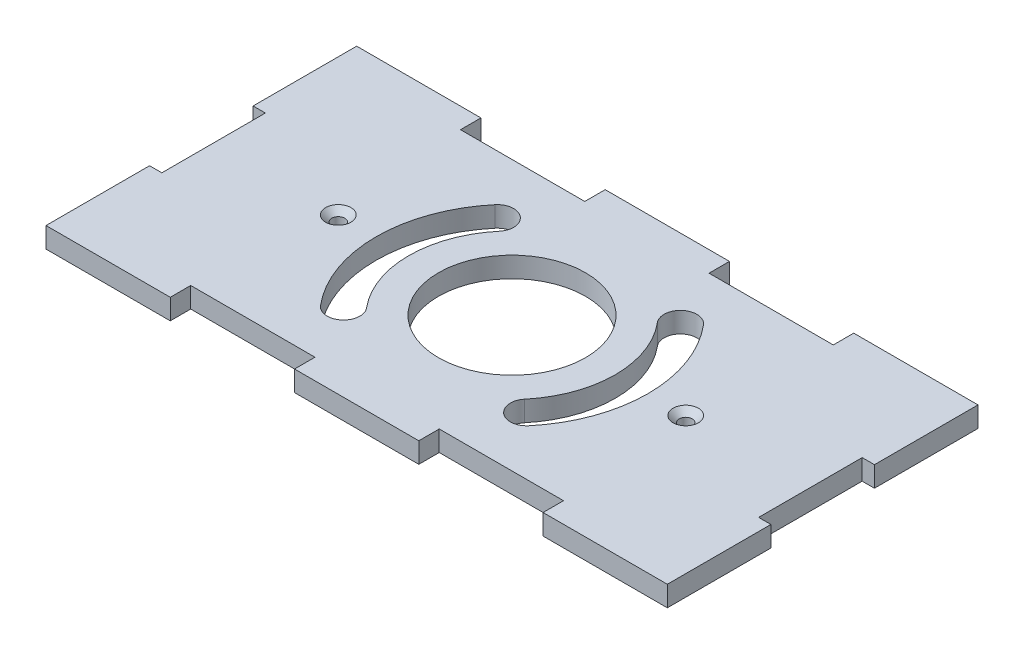
from build123d import *
from build123d.topology import SkipClean

# Parameters (mm, degrees)
BOSS_EXTRUDE1_DEPTH   = 5
MIRROR1_START         = -33
MIRROR1_OUTLINE_W     = 146
MIRROR1_OUTLINE_H     = 5
MIRROR1_DEPTH         = 66
MIRROR1_START_2       = -38
MIRROR1_2_OUTLINE_W   = 27.4
MIRROR1_2_OUTLINE_H   = 5
MIRROR1_2_OUTLINE_W_2 = 30.4
MIRROR1_2_DEPTH       = 76
MIRROR1_START_3       = 12.666666667
MIRROR1_3_OUTLINE_W   = 3
MIRROR1_3_OUTLINE_H   = 5
MIRROR1_3_DEPTH       = 25.333333333
MIRROR1_4_OUTLINE_W   = 3
MIRROR1_4_OUTLINE_H   = 5
MIRROR1_4_DEPTH       = 25.333333333
CUT_EXTRUDE1_DEPTH    = 86.117565755
SKETCH3_R             = 1.6
CUT_EXTRUDE2_DEPTH    = 86.117565755
CHAMFER1_SIZE         = 1.5


# Read off the part's stored shape, not the designer's step: Mirror1
with BuildPart() as part:
    # Sketch1 → Boss-Extrude1 (new body)
    with BuildSketch(Plane(origin=(0, 0, 0), x_dir=(1, 0, 0), z_dir=(0, 1, 0))):
        Polygon((-76, 38), (-76, 12.666666667), (-73, 12.666666667), (-73, 0), (0, 0), (0, 38), (-15.2, 38), (-15.2, 33), (-45.6, 33), (-45.6, 38), align=None)
    extrude(amount=BOSS_EXTRUDE1_DEPTH)

    # Mirror1 outline → Mirror1 (add)
    with BuildSketch(Plane.XY.offset(MIRROR1_START)):
        with Locations((0, 2.5)):
            Rectangle(MIRROR1_OUTLINE_W, MIRROR1_OUTLINE_H)
    extrude(amount=MIRROR1_DEPTH)

    # Mirror1 2 outline → Mirror1 2 (add)
    with BuildSketch(Plane.XY.offset(MIRROR1_START_2)):
        with Locations((-59.3, 2.5)):
            Rectangle(MIRROR1_2_OUTLINE_W, MIRROR1_2_OUTLINE_H)
        with Locations((0, 2.5)):
            Rectangle(MIRROR1_2_OUTLINE_W_2, MIRROR1_2_OUTLINE_H)
        with Locations((59.3, 2.5)):
            Rectangle(MIRROR1_2_OUTLINE_W, MIRROR1_2_OUTLINE_H)
    extrude(amount=MIRROR1_2_DEPTH)

    # Mirror1 3 outline → Mirror1 3 (add)
    with BuildSketch(Plane.XY.offset(MIRROR1_START_3)):
        with Locations((-74.5, 2.5)):
            Rectangle(MIRROR1_3_OUTLINE_W, MIRROR1_3_OUTLINE_H)
        with Locations((74.5, 2.5)):
            Rectangle(MIRROR1_3_OUTLINE_W, MIRROR1_3_OUTLINE_H)
    extrude(amount=MIRROR1_3_DEPTH)

    # Mirror1 4 outline → Mirror1 4 (add)
    with BuildSketch(Plane.XY.offset(MIRROR1_START_2)):
        with Locations((74.5, 2.5)):
            Rectangle(MIRROR1_4_OUTLINE_W, MIRROR1_4_OUTLINE_H)
    extrude(amount=MIRROR1_4_DEPTH)

    # Sketch2 → Cut-Extrude1 (cut, through all)
    with BuildSketch(Plane(origin=(0, 5, 0), x_dir=(1, 0, 0), z_dir=(0, 1, 0))):
        with BuildLine():
            Line((0, 18), (0, -18))
            ThreePointArc((0, -18), (-18, 0), (0, 18))
        make_face()
        with BuildLine():
            ThreePointArc((-19.342622189, 16.230387145), (-19.835649522, 21.865715356), (-25.470977734, 21.372688022))
            ThreePointArc((-25.470977734, 21.372688022), (-33.25, 0), (-25.470977734, -21.372688022))
            ThreePointArc((-25.470977734, -21.372688022), (-19.835649522, -21.865715356), (-19.342622189, -16.230387145))
            ThreePointArc((-19.342622189, -16.230387145), (-25.25, 0), (-19.342622189, 16.230387145))
        make_face()
    cut_extrude1 = extrude(amount=-CUT_EXTRUDE1_DEPTH, mode=Mode.SUBTRACT)

    # Sketch3 → Cut-Extrude2 (cut, through all)
    with BuildSketch(Plane(origin=(0, 5, 0), x_dir=(1, 0, 0), z_dir=(0, 1, 0))):
        with Locations(Location((-42.5, 0, 0), (0, 0, 270))):
            Circle(SKETCH3_R)
        with Locations(Location((42.5, 0, 0), (0, 0, 270))):
            Circle(SKETCH3_R)
    extrude(amount=-CUT_EXTRUDE2_DEPTH, mode=Mode.SUBTRACT)

    # Chamfer1
    chamfer1_edges = [part.edges().sort_by_distance(p)[0] for p in [
        (-42.5, 5, -1.6),
        (42.5, 5, -1.6),
    ]]
    chamfer(chamfer1_edges, length=CHAMFER1_SIZE)

    # Mirror3: Cut-Extrude1 across plane
    with SkipClean():  # the faces are left unmerged after this step: merging them gives an invalid solid
        add(cut_extrude1.mirror(Plane(origin=(0, 0, 0), x_dir=(0, 0, 1), z_dir=(1, 0, 0))), mode=Mode.SUBTRACT)


solid = part.part
